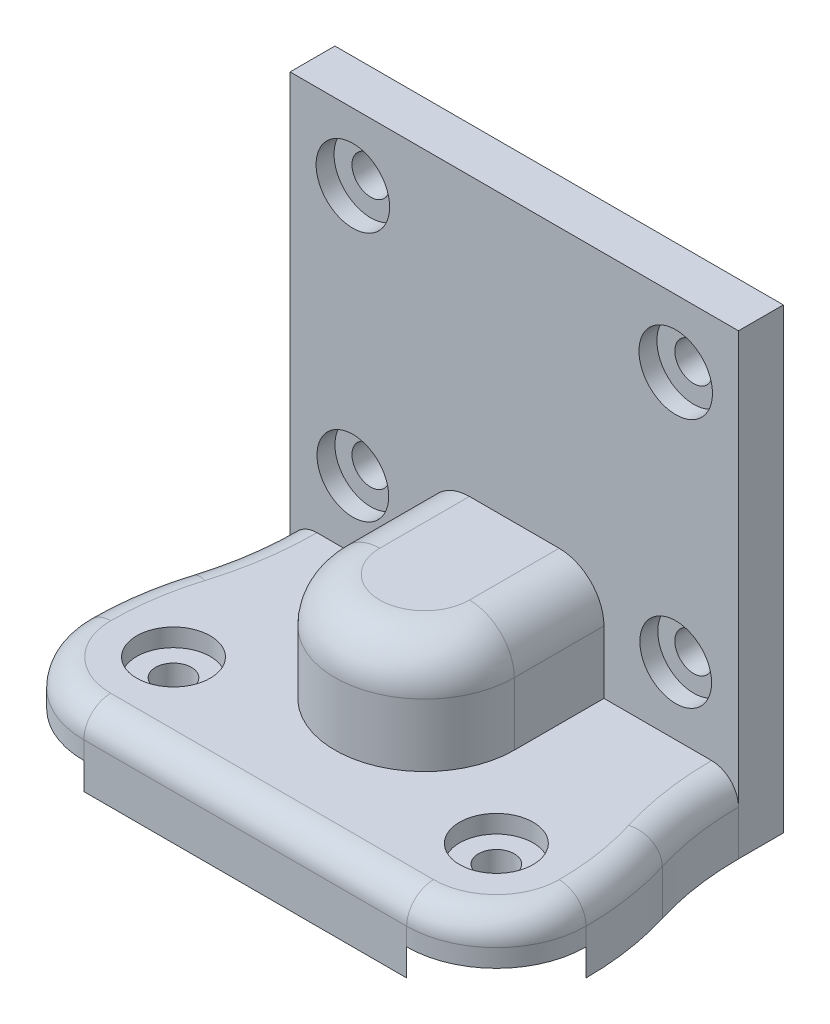
from build123d import *
from build123d.topology import SkipClean

# Parameters (mm, degrees)
SKETCH_1_R           = 2
EXTRUDE_1_DEPTH      = 5
EXTRUDE_5_DEPTH      = 18
SKETCH_6_W           = 40
SKETCH_6_H           = 5
EXTRUDE_6_DEPTH      = 25
SKETCH_7_W           = 40
SKETCH_7_H           = 5
EXTRUDE_7_DEPTH      = 27
SKETCH_9_R           = 10
CUT_EXTRUDE_4_DEPTH  = 50
SKETCH_10_W          = 8
SKETCH_10_H          = 5
EXTRUDE_9_DEPTH      = 20
CUT_EXTRUDE_8_DEPTH  = 20
CUT_EXTRUDE_9_DEPTH  = 20
SKETCH_16_W          = 40
SKETCH_16_H          = 4
EXTRUDE_10_DEPTH     = 5
SKETCH_17_W          = 40
SKETCH_17_H          = 4
EXTRUDE_12_DEPTH     = 12
SKETCH_18_R          = 1.5
CUT_EXTRUDE_10_DEPTH = 10
CUT_EXTRUDE_11_DEPTH = 10
SKETCH_22_W          = 39.912411086
SKETCH_22_H          = 12
CUT_EXTRUDE_12_DEPTH = 10
SKETCH_23_W          = 1.771441315
SKETCH_23_H          = 1.605869394
CUT_EXTRUDE_13_DEPTH = 10
SKETCH_24_W          = 40
SKETCH_24_H          = 4
EXTRUDE_13_DEPTH     = 7
SKETCH_26_R          = 1.5
CUT_EXTRUDE_14_DEPTH = 7
SKETCH_27_W          = 8
SKETCH_27_H          = 26.5
EXTRUDE_14_DEPTH     = 5
SKETCH_28_W          = 8
SKETCH_28_H          = 25
EXTRUDE_15_DEPTH     = 5
SKETCH_30_W          = 8
SKETCH_30_H          = 1.5
CUT_EXTRUDE_15_DEPTH = 5
SKETCH_31_R          = 2.52
CUT_EXTRUDE_16_DEPTH = 5
SKETCH_32_R          = 2.52
CUT_EXTRUDE_17_DEPTH = 5
CUT_EXTRUDE_18_DEPTH = 5
SKETCH_2_R           = 4
CUT_EXTRUDE_19_DEPTH = 3
SKETCH_35_W          = 4
SKETCH_35_H          = 12
CUT_EXTRUDE_20_DEPTH = 100
SKETCH_37_W          = 50
SKETCH_37_H          = 43
CUT_EXTRUDE_21_DEPTH = 100
SKETCH_38_W          = 50
SKETCH_38_H          = 43
SKETCH_38_R          = 10
EXTRUDE_20_DEPTH     = 5
SKETCH_39_W          = 50
SKETCH_39_H          = 43
SKETCH_39_W_2        = 40
SKETCH_39_H_2        = 30
EXTRUDE_21_DEPTH     = 5
CUT_EXTRUDE_START    = -100
SKETCH_41_R          = 2.1
SKETCH_41_R_2        = 10
CUT_EXTRUDE_23_DEPTH = 100
SKETCH_42_W          = 6
SKETCH_42_H          = 5
CUT_EXTRUDE_24_DEPTH = 13
SKETCH_43_R          = 4.1
CUT_EXTRUDE_27_DEPTH = 29
EXTRUDE_START        = 27
EXTRUDE_22_DEPTH     = 27
EXTRUDE_23_DEPTH     = 27
SKETCH_46_W          = 28
SKETCH_46_H          = 0.25
EXTRUDE_24_DEPTH     = 20
SKETCH_47_R          = 4
CUT_EXTRUDE_28_DEPTH = 2
CUT_EXTRUDE_29_DEPTH = 10
CUT_EXTRUDE_30_DEPTH = 10
SKETCH_50_W          = 27
SKETCH_50_H          = 11.6
SKETCH_50_H_2        = 10.600731696
SKETCH_50_W_2        = 5
SKETCH_50_H_3        = 9.36628082
CUT_EXTRUDE_31_DEPTH = 60
SKETCH_51_R          = 10
SKETCH_51_W          = 5.257466337
SKETCH_51_H          = 20
SKETCH_51_W_2        = 5.257304599
EXTRUDE_25_DEPTH     = 10
SKETCH_52_W          = 5
SKETCH_52_H          = 43
CUT_EXTRUDE_32_DEPTH = 50
EXTRUDE_26_DEPTH     = 20
SKETCH_57_R          = 6.05
CUT_EXTRUDE_33_DEPTH = 20
EXTRUDE_START_2      = -12
EXTRUDE_27_DEPTH     = 12
SKETCH_62_R          = 2
EXTRUDE_28_DEPTH     = 8
CUT_EXTRUDE_START_2  = -3
SKETCH_63_R          = 10
CUT_EXTRUDE_34_DEPTH = 3
FILLET_1_R           = 5
FILLET_2_R           = 3
SKETCH_65_R          = 4.1
CUT_EXTRUDE_35_DEPTH = 2


with BuildPart() as part:
    # 草图1 → 凸台-拉伸1 (new body)
    with BuildSketch(Plane.XY):
        Polygon((0, 21.5), (25, 21.5), (25, -21.5), (-25, -21.5), (-25, 21.5), align=None)
        with Locations((-18, 14)):
            Circle(SKETCH_1_R, mode=Mode.SUBTRACT)
        with Locations((-18, -14)):
            Circle(SKETCH_1_R, mode=Mode.SUBTRACT)
        with Locations((18, -14)):
            Circle(SKETCH_1_R, mode=Mode.SUBTRACT)
        with Locations((18, 14)):
            Circle(SKETCH_1_R, mode=Mode.SUBTRACT)
    extrude(amount=EXTRUDE_1_DEPTH)

    # 草图5 → 凸台-拉伸5 (add)
    with BuildSketch(Plane.XY.offset(5)):
        Polygon((0, 26.5), (20, 26.5), (20, 21.5), (-20, 21.5), (-20, 26.5), align=None)
    extrude(amount=-EXTRUDE_5_DEPTH)

    # 草图6 → 凸台-拉伸6 (add)
    with BuildSketch(Plane(origin=(0, 26.5, 0), x_dir=(1, 0, 0), z_dir=(0, 1, 0))):
        with Locations((0, 10.5)):
            Rectangle(SKETCH_6_W, SKETCH_6_H)
    extrude(amount=EXTRUDE_6_DEPTH)

    # 草图7 → 凸台-拉伸7 (add)
    with BuildSketch(Plane.XY.offset(-8)):
        with Locations((0, 49)):
            Rectangle(SKETCH_7_W, SKETCH_7_H)
    extrude(amount=EXTRUDE_7_DEPTH)

    # 草图9 → 切除-拉伸4 (cut)
    with BuildSketch(Plane(origin=(0, 0, 0), x_dir=(-1, 0, 0), z_dir=(0, 0, -1))):
        Circle(SKETCH_9_R)
    extrude(amount=-CUT_EXTRUDE_4_DEPTH, mode=Mode.SUBTRACT)

    # 草图10 → 凸台-拉伸9 (add)
    with BuildSketch(Plane(origin=(0, 51.5, 0), x_dir=(1, 0, 0), z_dir=(0, 1, 0))):
        with Locations((-24, -16.5)):
            Rectangle(SKETCH_10_W, SKETCH_10_H)
        with Locations((24, -16.5)):
            Rectangle(SKETCH_10_W, SKETCH_10_H)
    extrude(amount=-EXTRUDE_9_DEPTH)

    # 草图12 → 切除-拉伸8 (cut)
    with BuildSketch(Plane(origin=(0, 0, 14), x_dir=(-1, 0, 0), z_dir=(0, 0, -1))):
        with BuildLine():
            Line((28, 46), (28, 47))
            Line((28, 47), (27.949489743, 47))
            ThreePointArc((27.949489743, 47), (23, 46.5), (27.949489743, 46))
            Line((27.949489743, 46), (28, 46))
        make_face()
        with BuildLine():
            Line((27.949489743, 36), (28, 36))
            Line((28, 36), (28, 37))
            Line((28, 37), (27.949489743, 37))
            ThreePointArc((27.949489743, 37), (23, 36.5), (27.949489743, 36))
        make_face()
    extrude(amount=-CUT_EXTRUDE_8_DEPTH, mode=Mode.SUBTRACT)

    # 草图15 → 切除-拉伸9 (cut)
    with BuildSketch(Plane(origin=(0, 0, 14), x_dir=(-1, 0, 0), z_dir=(0, 0, -1))):
        with BuildLine():
            ThreePointArc((-27.949489743, 46), (-23, 46.5), (-27.949489743, 47))
            Line((-27.949489743, 47), (-28, 47))
            Line((-28, 47), (-28, 46))
            Line((-28, 46), (-27.949489743, 46))
        make_face()
        with BuildLine():
            Line((-27.949489743, 37), (-28, 37))
            Line((-28, 37), (-28, 36))
            Line((-28, 36), (-27.949489743, 36))
            ThreePointArc((-27.949489743, 36), (-23, 36.5), (-27.949489743, 37))
        make_face()
    extrude(amount=-CUT_EXTRUDE_9_DEPTH, mode=Mode.SUBTRACT)

    # 草图16 → 凸台-拉伸10 (add)
    with BuildSketch(Plane(origin=(0, 51.5, 0), x_dir=(1, 0, 0), z_dir=(0, 1, 0))):
        with Locations((0, -21)):
            Rectangle(SKETCH_16_W, SKETCH_16_H)
    extrude(amount=-EXTRUDE_10_DEPTH)

    # 草图17 → 凸台-拉伸12 (add)
    with BuildSketch(Plane(origin=(0, 51.5, 0), x_dir=(1, 0, 0), z_dir=(0, 1, 0))):
        with Locations((0, -21)):
            Rectangle(SKETCH_17_W, SKETCH_17_H)
    extrude(amount=EXTRUDE_12_DEPTH)

    # 草图18 → 切除-拉伸10 (cut)
    with BuildSketch(Plane(origin=(0, 0, 19), x_dir=(-1, 0, 0), z_dir=(0, 0, -1))):
        with Locations((6, 59.5)):
            Circle(SKETCH_18_R)
        with Locations((13, 59.5)):
            Circle(SKETCH_18_R)
    extrude(amount=-CUT_EXTRUDE_10_DEPTH, mode=Mode.SUBTRACT)

    # 草图20 → 切除-拉伸11 (cut)
    with BuildSketch(Plane.XY.offset(23)):
        with BuildLine():
            ThreePointArc((8, 63.5), (16.485281374, 59.985281374), (20, 51.5))
            Line((20, 51.5), (20, 63.5))
            Line((20, 63.5), (8, 63.5))
        make_face()
    extrude(amount=-CUT_EXTRUDE_11_DEPTH, mode=Mode.SUBTRACT)

    # 草图22 → 切除-拉伸12 (cut)
    with BuildSketch(Plane.XY.offset(23)):
        with Locations((-0.043794457, 57.5)):
            Rectangle(SKETCH_22_W, SKETCH_22_H)
    extrude(amount=-CUT_EXTRUDE_12_DEPTH, mode=Mode.SUBTRACT)

    # 草图23 → 切除-拉伸13 (cut)
    with BuildSketch(Plane.XY.offset(23)):
        with Locations((20.269466875, 52.302934697)):
            Rectangle(SKETCH_23_W, SKETCH_23_H)
    extrude(amount=-CUT_EXTRUDE_13_DEPTH, mode=Mode.SUBTRACT)

    # 草图24 → 凸台-拉伸13 (add)
    with BuildSketch(Plane(origin=(0, 51.5, 0), x_dir=(1, 0, 0), z_dir=(0, 1, 0))):
        with Locations((0, -21)):
            Rectangle(SKETCH_24_W, SKETCH_24_H)
    extrude(amount=EXTRUDE_13_DEPTH)

    # 草图26 → 切除-拉伸14 (cut)
    with BuildSketch(Plane.XY.offset(23)):
        with Locations((-13, 54.5)):
            Circle(SKETCH_26_R)
        with Locations((-6, 54.5)):
            Circle(SKETCH_26_R)
    extrude(amount=-CUT_EXTRUDE_14_DEPTH, mode=Mode.SUBTRACT)

    # 草图27 → 凸台-拉伸14 (add)
    with BuildSketch(Plane.XY.offset(19)):
        with Locations((24, 38.25)):
            Rectangle(SKETCH_27_W, SKETCH_27_H)
    extrude(amount=-EXTRUDE_14_DEPTH)

    # 草图28 → 凸台-拉伸15 (add)
    with BuildSketch(Plane.XY.offset(19)):
        with Locations((-24, 39)):
            Rectangle(SKETCH_28_W, SKETCH_28_H)
    extrude(amount=-EXTRUDE_15_DEPTH)

    # 草图30 → 切除-拉伸15 (cut)
    with BuildSketch(Plane.XY.offset(19)):
        with Locations((24, 25.75)):
            Rectangle(SKETCH_30_W, SKETCH_30_H)
    extrude(amount=-CUT_EXTRUDE_15_DEPTH, mode=Mode.SUBTRACT)

    # 草图31 → 切除-拉伸16 (cut)
    with BuildSketch(Plane.XY.offset(19)):
        with Locations((25.5, 41.5)):
            Circle(SKETCH_31_R)
        with Locations((25.5, 31.5)):
            Circle(SKETCH_31_R)
    extrude(amount=-CUT_EXTRUDE_16_DEPTH, mode=Mode.SUBTRACT)

    # 草图32 → 切除-拉伸17 (cut)
    with BuildSketch(Plane.XY.offset(19)):
        with Locations((-25.5, 41.5)):
            Circle(SKETCH_32_R)
        with Locations((-25.5, 31.5)):
            Circle(SKETCH_32_R)
    extrude(amount=-CUT_EXTRUDE_17_DEPTH, mode=Mode.SUBTRACT)

    # 草图33 → 切除-拉伸18 (cut)
    with BuildSketch(Plane(origin=(0, 0, 19), x_dir=(-1, 0, 0), z_dir=(0, 0, -1))):
        with BuildLine():
            Line((-20, 58.5), (-20, 51.5))
            ThreePointArc((-20, 51.5), (-17.949747468, 56.449747468), (-13, 58.5))
            Line((-13, 58.5), (-20, 58.5))
        make_face()
        with BuildLine():
            Line((20, 58.5), (13, 58.5))
            ThreePointArc((13, 58.5), (17.949747468, 56.449747468), (20, 51.5))
            Line((20, 51.5), (20, 58.5))
        make_face()
    extrude(amount=-CUT_EXTRUDE_18_DEPTH, mode=Mode.SUBTRACT)

    # 草图2 → 切除-拉伸19 (cut)
    with BuildSketch(Plane.XY.offset(5)):
        with Locations((18, 14)):
            Circle(SKETCH_2_R)
        with Locations((-18, 14)):
            Circle(SKETCH_2_R)
        with Locations((-18, -14)):
            Circle(SKETCH_2_R)
        with Locations((18, -14)):
            Circle(SKETCH_2_R)
    extrude(amount=-CUT_EXTRUDE_19_DEPTH, mode=Mode.SUBTRACT)

    # 草图35 → 切除-拉伸20 (cut)
    with BuildSketch(Plane.ZY.offset(20)):
        with Locations((21, 52.5)):
            Rectangle(SKETCH_35_W, SKETCH_35_H)
    extrude(amount=-CUT_EXTRUDE_20_DEPTH, mode=Mode.SUBTRACT)

    # 草图37 → 切除-拉伸21 (cut)
    with BuildSketch(Plane.XY.offset(5)):
        Rectangle(SKETCH_37_W, SKETCH_37_H)
    extrude(amount=-CUT_EXTRUDE_21_DEPTH, mode=Mode.SUBTRACT)

    # 草图38 → 凸台-拉伸20 (add)
    with BuildSketch(Plane(origin=(0, 0, -13), x_dir=(-1, 0, 0), z_dir=(0, 0, -1))):
        with Locations((0, 36.5)):
            Rectangle(SKETCH_38_W, SKETCH_38_H)
        with Locations((0, 36.5)):
            Circle(SKETCH_38_R, mode=Mode.SUBTRACT)
    extrude(amount=EXTRUDE_20_DEPTH)

    # 草图39 → 凸台-拉伸21 (add)
    with BuildSketch(Plane.XY.offset(-13)):
        with Locations((0, 36.5)):
            Rectangle(SKETCH_39_W, SKETCH_39_H)
        with Locations((0, 36.5)):
            Rectangle(SKETCH_39_W_2, SKETCH_39_H_2, mode=Mode.SUBTRACT)
    extrude(amount=EXTRUDE_21_DEPTH)

    # 草图41 → 切除-拉伸23 (cut)
    with BuildSketch(Plane(origin=(0, 0, -18), x_dir=(-1, 0, 0), z_dir=(0, 0, -1)).offset(CUT_EXTRUDE_START)):
        with Locations((-18, 50.5)):
            Circle(SKETCH_41_R)
        with Locations((18, 50.5)):
            Circle(SKETCH_41_R)
        with Locations((18, 22.5)):
            Circle(SKETCH_41_R)
        with Locations((-18, 22.5)):
            Circle(SKETCH_41_R)
        with Locations(Location((0, 36.5, 0), (0, 0, 270))):
            Circle(SKETCH_41_R_2)
    extrude(amount=CUT_EXTRUDE_23_DEPTH, mode=Mode.SUBTRACT)

    # 草图42 → 切除-拉伸24 (cut)
    with BuildSketch(Plane.XY.offset(5)):
        with Locations((-17, 24)):
            Rectangle(SKETCH_42_W, SKETCH_42_H)
        with Locations((17, 24)):
            Rectangle(SKETCH_42_W, SKETCH_42_H)
    extrude(amount=-CUT_EXTRUDE_24_DEPTH, mode=Mode.SUBTRACT)

    # 草图43 → 切除-拉伸27 (cut)
    with BuildSketch(Plane.XY.offset(19)):
        with Locations((-18, 50.5)):
            Circle(SKETCH_43_R)
        with Locations((18, 50.5)):
            Circle(SKETCH_43_R)
    extrude(amount=-CUT_EXTRUDE_27_DEPTH, mode=Mode.SUBTRACT)

    # 草图44 → 凸台-拉伸22 (add)
    with SkipClean():  # the faces are left unmerged after this step: merging them gives an invalid solid
        with BuildSketch(Plane.XY.offset(-8).offset(EXTRUDE_START)):
            with BuildLine():
                Line((-25, 46.5), (-20, 46.5))
                Line((-20, 46.5), (-20, 46.920893966))
                ThreePointArc((-20, 46.920893966), (-22.1, 50.5), (-20, 54.079106034))
                Line((-20, 54.079106034), (-20, 58))
                Line((-20, 58), (-25, 58))
                Line((-25, 58), (-25, 46.5))
            make_face()
        extrude(amount=-EXTRUDE_22_DEPTH)

    # 草图45 → 凸台-拉伸23 (add)
    with SkipClean():  # the faces are left unmerged after this step: merging them gives an invalid solid
        with BuildSketch(Plane.XY.offset(-8).offset(EXTRUDE_START)):
            with BuildLine():
                Line((18.9, 46.5), (25, 46.5))
                Line((25, 46.5), (25, 58))
                Line((25, 58), (20, 58))
                Line((20, 58), (20, 54.079106034))
                ThreePointArc((20, 54.079106034), (22.057488307, 49.911112372), (18.9, 46.5))
            make_face()
        extrude(amount=-EXTRUDE_23_DEPTH)

    # 草图46 → 凸台-拉伸24 (add)
    with SkipClean():  # the faces are left unmerged after this step: merging them gives an invalid solid
        with BuildSketch(Plane.XY.offset(5)):
            with Locations((0, 26.625)):
                Rectangle(SKETCH_46_W, SKETCH_46_H)
        extrude(amount=-EXTRUDE_24_DEPTH)

    # 草图47 → 切除-拉伸28 (cut)
    with SkipClean():  # the faces are left unmerged after this step: merging them gives an invalid solid
        with BuildSketch(Plane.XY.offset(-8)):
            with Locations((-18, 22.5)):
                Circle(SKETCH_47_R)
            with Locations((18, 22.5)):
                Circle(SKETCH_47_R)
        extrude(amount=-CUT_EXTRUDE_28_DEPTH, mode=Mode.SUBTRACT)

    # 草图48 → 切除-拉伸29 (cut)
    with SkipClean():  # the faces are left unmerged after this step: merging them gives an invalid solid
        with BuildSketch(Plane.XY.offset(-8)):
            with BuildLine():
                Line((-25, 46.5), (-25, 26.5))
                ThreePointArc((-25, 26.5), (-19.999999498, 36.5), (-25, 46.5))
            make_face()
        extrude(amount=-CUT_EXTRUDE_29_DEPTH, mode=Mode.SUBTRACT)

    # 草图49 → 切除-拉伸30 (cut)
    with SkipClean():  # the faces are left unmerged after this step: merging them gives an invalid solid
        with BuildSketch(Plane.XY.offset(-8)):
            with BuildLine():
                Line((25, 46.5), (25, 26.5))
                ThreePointArc((25, 26.5), (20, 36.5), (25, 46.5))
            make_face()
        extrude(amount=-CUT_EXTRUDE_30_DEPTH, mode=Mode.SUBTRACT)

    # 草图50 → 切除-拉伸31 (cut)
    with BuildSketch(Plane.ZY.offset(28)):
        with Locations((5.5, 52.2)):
            Rectangle(SKETCH_50_W, SKETCH_50_H)
        Polygon((-8, 26.5), (19, 26.5), (19, 31.81685959), (14, 31.81685959), (14, 41.18314041), (19, 41.18314041), (19, 46.4), (-8, 46.4), align=None)
        with Locations((5.5, 21.199634152)):
            Rectangle(SKETCH_50_W, SKETCH_50_H_2)
        with Locations((16.5, 36.5)):
            Rectangle(SKETCH_50_W_2, SKETCH_50_H_3)
    extrude(amount=-CUT_EXTRUDE_31_DEPTH, mode=Mode.SUBTRACT)

    # 草图51 → 凸台-拉伸25 (add)
    with BuildSketch(Plane.XY.offset(-8)):
        with Locations((0, 36.5)):
            Circle(SKETCH_51_R)
        with Locations((-22.371266832, 36.5)):
            Rectangle(SKETCH_51_W, SKETCH_51_H)
        with Locations((22.371347701, 36.5)):
            Rectangle(SKETCH_51_W_2, SKETCH_51_H)
    extrude(amount=-EXTRUDE_25_DEPTH)

    # 草图52 → 切除-拉伸32 (cut)
    with BuildSketch(Plane.ZY.offset(25)):
        with Locations((-15.5, 36.5)):
            Rectangle(SKETCH_52_W, SKETCH_52_H)
    extrude(amount=-CUT_EXTRUDE_32_DEPTH, mode=Mode.SUBTRACT)

    # 草图53 → 凸台-拉伸26 (add)
    with BuildSketch(Plane.XY.offset(-8)):
        Polygon((-10, 22.5), (-10, 26.5), (10, 26.5), (10, 22.5), (10, 18.5), (-10, 18.5), align=None)
    extrude(amount=EXTRUDE_26_DEPTH)

    # 草图57 → 切除-拉伸33 (cut)
    with BuildSketch(Plane(origin=(0, 26.5, 0), x_dir=(1, 0, 0), z_dir=(0, 1, 0))):
        with Locations(Location((0, -2, 0), (0, 0, 270))):
            Circle(SKETCH_57_R)
        with BuildLine():
            ThreePointArc((0, -12), (-7.071067812, -9.071067812), (-10, -2))
            Line((-10, -2), (-10, -12))
            Line((-10, -12), (0, -12))
        make_face()
        with BuildLine():
            ThreePointArc((10, -2), (7.071067812, -9.071067812), (0, -12))
            Line((0, -12), (10, -12))
            Line((10, -12), (10, -2))
        make_face()
    extrude(amount=-CUT_EXTRUDE_33_DEPTH, mode=Mode.SUBTRACT)

    # 草图58 → 凸台-拉伸27 (add)
    with SkipClean():  # the faces are left unmerged after this step: merging them gives an invalid solid
        with BuildSketch(Plane.XZ.offset(-15).offset(EXTRUDE_START_2)):
            with BuildLine():
                Line((-10, -8), (-10, 2))
                ThreePointArc((-10, 2), (0, 12), (10, 2))
                Line((10, 2), (10, -8))
                Line((10, -8), (-10, -8))
            make_face()
        extrude(amount=EXTRUDE_27_DEPTH)
    add(part.part.scale(1), mode=Mode.REPLACE)  # the faces are merged on a copy

    # 草图62 → 凸台-拉伸28 (add)
    # profile 1 of 2: a face of its own
    with BuildSketch(Plane.XZ.offset(-15)):
        with BuildLine():
            ThreePointArc((25, -8), (25.377085973, -2.944062896), (26.5, 2))
            ThreePointArc((26.5, 2), (27.622914027, 6.944062896), (28, 12))
            ThreePointArc((28, 12), (25.071067812, 19.071067812), (18, 22))
            Line((18, 22), (-18, 22))
            ThreePointArc((-18, 22), (-25.071067812, 19.071067812), (-28, 12))
            ThreePointArc((-28, 12), (-27.622914027, 6.944062896), (-26.5, 2))
            ThreePointArc((-26.5, 2), (-25.377085973, -2.944062896), (-25, -8))
            Line((-25, -8), (-10, -8))
            Line((-10, -8), (-10, 2))
            ThreePointArc((-10, 2), (0, 12), (10, 2))
            Line((10, 2), (10, -8))
            Line((10, -8), (25, -8))
        make_face()
        with Locations(Location((-18, 12, 0), (0, 0, 270))):
            Circle(SKETCH_62_R, mode=Mode.SUBTRACT)
        with Locations(Location((18, 12, 0), (0, 0, 270))):
            Circle(SKETCH_62_R, mode=Mode.SUBTRACT)
    # profile 2 of 2: a face of its own
    with BuildSketch(Plane.XZ.offset(-15)):
        with BuildLine():
            Line((-10, -8), (-25, -8))
            Line((-25, -8), (-25, -13))
            Line((-25, -13), (25, -13))
            Line((25, -13), (25, -8))
            Line((25, -8), (10, -8))
            Line((10, -8), (10, 2))
            ThreePointArc((10, 2), (0, 12), (-10, 2))
            Line((-10, 2), (-10, -8))
        make_face()
    extrude(amount=EXTRUDE_28_DEPTH)

    # 草图63 → 切除-拉伸34 (cut)
    with BuildSketch(Plane.XZ.offset(-7).offset(CUT_EXTRUDE_START_2)):
        with Locations((-18, 12)):
            Circle(SKETCH_63_R)
        with Locations((18, 12)):
            Circle(SKETCH_63_R)
    extrude(amount=CUT_EXTRUDE_34_DEPTH, mode=Mode.SUBTRACT)

    # 圆角1
    fillet_1_edges = [part.edges().sort_by_distance(p)[0] for p in [
        (0, 27, 12),
        (-10, 27, -3),
        (10, 27, -3),
    ]]
    fillet(fillet_1_edges, radius=FILLET_1_R)

    # 圆角2
    # the kernel refuses this fillet: 3 mm, written as the material it takes off along each edge
    with BuildSketch(Plane(origin=(59.083333333, 15, -8), x_dir=(-1, 0, 0), z_dir=(0, 0, -1))) as fillet_2_piece_1:
        with BuildLine():
            CenterArc((34.083333333 + FILLET_2_R, -FILLET_2_R), FILLET_2_R, 90, 90)
            Line((34.083333333, -FILLET_2_R), (34.083333333, 0))
            Line((34.083333333, 0), (34.083333333 + FILLET_2_R, 0))
        make_face()
    revolve(axis=Axis((59.083333333, 15, -8), (0, 1, 0)), revolution_arc=17.06153122, mode=Mode.SUBTRACT)
    with BuildSketch(Plane(origin=(18, 15, 22), x_dir=(0, 0, -1), z_dir=(-1, 0, 0))) as fillet_2_piece_2:
        with BuildLine():
            CenterArc((FILLET_2_R, FILLET_2_R), FILLET_2_R, 180, 90)
            Line((0, FILLET_2_R), (0, 0))
            Line((0, 0), (FILLET_2_R, 0))
        make_face()
    extrude(amount=36, mode=Mode.SUBTRACT)
    with BuildSketch(Plane(origin=(-18, 15, 12), x_dir=(0, 0, 1), z_dir=(1, 0, 0))) as fillet_2_piece_3:
        with BuildLine():
            CenterArc((10 - FILLET_2_R, FILLET_2_R), FILLET_2_R, 270, 90)
            Line((10, FILLET_2_R), (10, 0))
            Line((10, 0), (10 - FILLET_2_R, 0))
        make_face()
    revolve(axis=Axis((-18, 15, 12), (0, -1, 0)), revolution_arc=90, mode=Mode.SUBTRACT)
    with BuildSketch(Plane(origin=(6.083333333, 15, 12), x_dir=(-1, 0, 0), z_dir=(0, 0, 1))) as fillet_2_piece_4:
        with BuildLine():
            CenterArc((34.083333333 - FILLET_2_R, FILLET_2_R), FILLET_2_R, 270, 90)
            Line((34.083333333, FILLET_2_R), (34.083333333, 0))
            Line((34.083333333, 0), (34.083333333 - FILLET_2_R, 0))
        make_face()
    revolve(axis=Axis((6.083333333, 15, 12), (0, -1, 0)), revolution_arc=17.06153122, mode=Mode.SUBTRACT)
    with BuildSketch(Plane(origin=(-59.083333333, 15, -8), x_dir=(0.9559902200488997, 0, 0.2933985330073357), z_dir=(-0.2933985330073357, 0, 0.9559902200488997))) as fillet_2_piece_5:
        with BuildLine():
            CenterArc((34.083333333 + FILLET_2_R, -FILLET_2_R), FILLET_2_R, 90, 90)
            Line((34.083333333, -FILLET_2_R), (34.083333333, 0))
            Line((34.083333333, 0), (34.083333333 + FILLET_2_R, 0))
        make_face()
    revolve(axis=Axis((-59.083333333, 15, -8), (0, 1, 0)), revolution_arc=17.06153122, mode=Mode.SUBTRACT)
    with BuildSketch(Plane(origin=(18, 15, 12), x_dir=(1, 0, 0), z_dir=(0, 0, -1))) as fillet_2_piece_6:
        with BuildLine():
            CenterArc((10 - FILLET_2_R, FILLET_2_R), FILLET_2_R, 270, 90)
            Line((10, FILLET_2_R), (10, 0))
            Line((10, 0), (10 - FILLET_2_R, 0))
        make_face()
    revolve(axis=Axis((18, 15, 12), (0, -1, 0)), revolution_arc=90, mode=Mode.SUBTRACT)
    with BuildSketch(Plane(origin=(-6.083333333, 15, 12), x_dir=(0.955990220048899, 0, -0.2933985330073376), z_dir=(-0.2933985330073376, 0, -0.955990220048899))) as fillet_2_piece_7:
        with BuildLine():
            CenterArc((34.083333333 - FILLET_2_R, FILLET_2_R), FILLET_2_R, 270, 90)
            Line((34.083333333, FILLET_2_R), (34.083333333, 0))
            Line((34.083333333, 0), (34.083333333 - FILLET_2_R, 0))
        make_face()
    revolve(axis=Axis((-6.083333333, 15, 12), (0, -1, 0)), revolution_arc=17.06153122, mode=Mode.SUBTRACT)

    # 草图65 → 切除-拉伸35 (cut)
    with BuildSketch(Plane(origin=(0, 15, 0), x_dir=(1, 0, 0), z_dir=(0, 1, 0))):
        with Locations(Location((-18, -12, 0), (0, 0, 270))):
            Circle(SKETCH_65_R)
        with Locations(Location((18, -12, 0), (0, 0, 270))):
            Circle(SKETCH_65_R)
    extrude(amount=-CUT_EXTRUDE_35_DEPTH, mode=Mode.SUBTRACT)


solid = part.part
